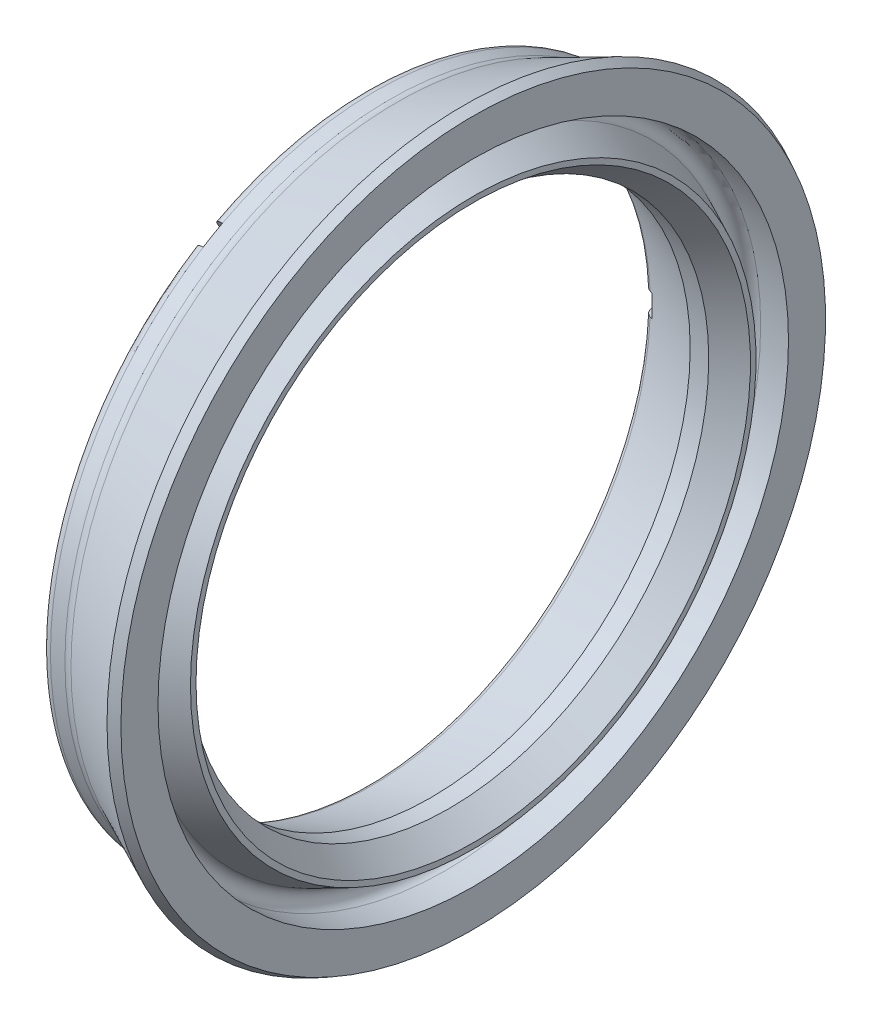
from build123d import *

# Parameters (mm, degrees)
FILLET1_R          = 1
CUT_EXTRUDE1_DEPTH = 0.1
SKETCH3_W          = 1
SKETCH3_H          = 1.2
CUT_EXTRUDE2_DEPTH = 28.834600908
CIRPATTERN1_COUNT  = 3


with BuildPart() as part:
    # Sketch1 → Revolve1 (revolve)
    with BuildSketch(Plane.XY):
        with BuildLine():
            Line((0, 15.47657924), (0, 17))
            ThreePointArc((0, 17), (0.146446609, 17.353553391), (0.5, 17.5))
            Line((0.5, 17.5), (1.5, 17.5))
            Line((1.5, 17.5), (5.3, 19.25))
            Line((5.3, 19.25), (5.8, 19))
            Line((5.8, 19), (5.8, 17))
            Line((5.8, 17), (4.3, 17))
            ThreePointArc((4.3, 17), (3.811822126, 16.608084983), (4.088941212, 16.046729454))
            Line((4.088941212, 16.046729454), (5.8, 15.25))
            Line((5.8, 15.25), (5.8, 14.95))
            Line((5.8, 14.95), (4.5, 14))
            Line((4.5, 14), (3.5, 14))
            Line((3.5, 14), (0.348764329, 15))
            ThreePointArc((0.348764329, 15), (0.096504129, 15.181297879), (0, 15.47657924))
        make_face()
    revolve(axis=Axis((0, 0, 0), (1, 0, 0)))

    # Fillet1
    fillet1_edges = [part.edges().sort_by_distance(p)[0] for p in [
        (1.5, -17.5, 0),
    ]]
    fillet(fillet1_edges, radius=FILLET1_R)

    # Sketch2 → Cut-Extrude1 (cut)
    # profile 1 of 13: a face of its own
    with BuildSketch(Plane.ZY):
        with BuildLine():
            Line((-5.513236692, 15.646736619), (-5.363557205, 15.696576363))
            add(Edge.make_bspline(
                [(-5.363557205, 15.696576363), (-5.353512255, 15.699826939), (-5.334289843, 15.70604737), (-5.30673904, 15.715099859), (-5.281364662, 15.72228272), (-5.258570361, 15.728853183), (-5.238105187, 15.733868692), (-5.220182011, 15.738282269), (-5.204518152, 15.740934727), (-5.1948641, 15.742169507), (-5.190480282, 15.742730209)],
                knots=[0, 0, 0, 0, 1.412503745, 2.703022838, 3.879057233, 4.940239887, 5.876218095, 6.697914565, 7.408734662, 8, 8, 8, 8], degree=3))
            add(Edge.make_bspline(
                [(-5.190480282, 15.742730209), (-5.184555288, 15.743203754), (-5.172822615, 15.744141467), (-5.155334297, 15.743794102), (-5.13832217, 15.741943867), (-5.121723228, 15.739167961), (-5.105588102, 15.734773302), (-5.089895179, 15.728996409), (-5.074596319, 15.721869467), (-5.059739804, 15.71362487), (-5.045598172, 15.704010342), (-5.032524099, 15.693098164), (-5.0203499, 15.681188019), (-5.009401397, 15.667970954), (-4.999722953, 15.653478799), (-4.990770581, 15.638031924), (-4.983107815, 15.621303853), (-4.97885988, 15.609588993), (-4.976698231, 15.603627645)],
                knots=[0, 0, 0, 0, 1.02975508, 2.039121114, 3.025811522, 3.993908284, 4.952930606, 5.919565219, 6.888900862, 7.875417496, 8.861543025, 9.847842398, 10.823348846, 11.809648219, 12.816292897, 13.840664528, 14.901177562, 16, 16, 16, 16], degree=3))
            add(Edge.make_bspline(
                [(-4.976698231, 15.603627645), (-4.973678409, 15.59359914), (-4.967765538, 15.573963128), (-4.964063446, 15.54390869), (-4.964249386, 15.514506201), (-4.968890484, 15.485953365), (-4.977814283, 15.458720436), (-4.990531553, 15.43294728), (-5.007870572, 15.40935199), (-5.025165341, 15.391139143), (-5.041252253, 15.377645777), (-5.054949222, 15.367674162), (-5.070219401, 15.358059909), (-5.087102374, 15.348865521), (-5.105305456, 15.339655945), (-5.125177032, 15.331087185), (-5.146454789, 15.322516357), (-5.161343337, 15.317346217), (-5.169005923, 15.314685337)],
                knots=[0, 0, 0, 0, 1.27216696, 2.490927996, 3.667247005, 4.839249893, 5.994210959, 7.142185145, 8.319939347, 9.542575186, 10.188263018, 10.871976625, 11.602166358, 12.381700848, 13.209986021, 14.082954318, 15.013367326, 16, 16, 16, 16], degree=3))
            Line((-5.169005923, 15.314685337), (-4.782307205, 15.055390466))
            Line((-4.782307205, 15.055390466), (-4.875416179, 15.024300722))
            Line((-4.875416179, 15.024300722), (-5.261473872, 15.283916107))
            Line((-5.261473872, 15.283916107), (-5.304262333, 15.269653286))
            Line((-5.304262333, 15.269653286), (-5.187916179, 14.920294312))
            Line((-5.187916179, 14.920294312), (-5.263076436, 14.895294312))
            Line((-5.263076436, 14.895294312), (-5.513236692, 15.646736619))
        make_face()
        with BuildLine():
            Line((-5.413557205, 15.598178927), (-5.328461051, 15.342730209))
            Line((-5.328461051, 15.342730209), (-5.198973872, 15.384877645))
            add(Edge.make_bspline(
                [(-5.198973872, 15.384877645), (-5.192926625, 15.386929713), (-5.181260543, 15.390888474), (-5.164510314, 15.397139017), (-5.149177995, 15.403522453), (-5.135182053, 15.409955132), (-5.122528934, 15.416304245), (-5.111282356, 15.422703253), (-5.1013875, 15.429119234), (-5.090196069, 15.437762932), (-5.078266711, 15.449489769), (-5.066333554, 15.464919175), (-5.057467632, 15.482068176), (-5.05124012, 15.500328868), (-5.047686483, 15.519392357), (-5.047079556, 15.538827702), (-5.049231306, 15.558419166), (-5.05299564, 15.571086302), (-5.054903359, 15.57750585)],
                knots=[0, 0, 0, 0, 1.11744946, 2.155734408, 3.127910899, 4.023013382, 4.850760167, 5.604407998, 6.286288709, 6.912664474, 8.076087043, 9.203462662, 10.311488627, 11.43777859, 12.569023046, 13.691388168, 14.83002394, 16, 16, 16, 16], degree=3))
            add(Edge.make_bspline(
                [(-5.054903359, 15.57750585), (-5.057187423, 15.58356699), (-5.061703863, 15.595552107), (-5.071477172, 15.612070753), (-5.083626091, 15.626787638), (-5.097910813, 15.639532291), (-5.113614236, 15.650218151), (-5.130424906, 15.658421386), (-5.148216393, 15.663522682), (-5.163699372, 15.665743048), (-5.176980519, 15.66596657), (-5.188217442, 15.665054081), (-5.200726713, 15.663426778), (-5.21448505, 15.661042908), (-5.229445635, 15.657618413), (-5.245608966, 15.653231444), (-5.263085147, 15.648114458), (-5.275104362, 15.644254058), (-5.281345667, 15.64224944)],
                knots=[0, 0, 0, 0, 1.15589625, 2.285634727, 3.41141331, 4.553866835, 5.695083182, 6.796720813, 7.881224103, 8.989665977, 9.581636446, 10.251605876, 11.002340783, 11.835749139, 12.74594281, 13.74401499, 14.828518281, 16, 16, 16, 16], degree=3))
            Line((-5.281345667, 15.64224944), (-5.413557205, 15.598178927))
        make_face(mode=Mode.SUBTRACT)
    # profile 2 of 13: a face of its own
    with BuildSketch(Plane.ZY):
        Polygon((-4.846118454, 15.87339904), (-4.769035121, 15.895995193), (-4.566631275, 15.203847757), (-4.272400506, 15.28990545), (-4.25076589, 15.215866988), (-4.622079993, 15.107213142), align=None)
    # profile 3 of 13: a face of its own
    with BuildSketch(Plane.ZY):
        Polygon((-4.12826997, 15.248587983), (-4.319616124, 16.022145675), (-4.3027892, 16.026312342), (-3.642052021, 15.561408495), (-3.78852638, 16.153555931), (-3.712404585, 16.172466188), (-3.521058431, 15.398908495), (-3.538366124, 15.394581572), (-4.193173816, 15.853075162), (-4.048462277, 15.268299521), align=None)
    # profile 4 of 13: a face of its own
    with BuildSketch(Plane.ZY):
        Polygon((-3.241907405, 16.195323355), (-3.256009969, 16.271284893), (-2.827484328, 16.350772073), (-2.813381764, 16.274810534), (-2.987580482, 16.242598996), (-2.856811251, 15.537631047), (-2.936458687, 15.522727201), (-3.067227918, 16.22769515), align=None)
    # profile 5 of 13: a face of its own
    with BuildSketch(Plane.ZY):
        with BuildLine():
            Line((-2.671946245, 15.722817863), (-2.611048809, 15.773138376))
            add(Edge.make_bspline(
                [(-2.611048809, 15.773138376), (-2.603664835, 15.763773446), (-2.589494957, 15.745802101), (-2.566776036, 15.721931274), (-2.543740059, 15.702457526), (-2.520955937, 15.686685633), (-2.497768328, 15.675388744), (-2.474446557, 15.668460999), (-2.4509956, 15.665144266), (-2.435567434, 15.666735896), (-2.427875732, 15.667529402)],
                knots=[0, 0, 0, 0, 1.288691563, 2.473004974, 3.554644125, 4.544373842, 5.461179188, 6.328941456, 7.166894914, 8, 8, 8, 8], degree=3))
            add(Edge.make_bspline(
                [(-2.427875732, 15.667529402), (-2.42136949, 15.66874991), (-2.408462352, 15.671171164), (-2.389979592, 15.677740916), (-2.372430116, 15.686316454), (-2.356086022, 15.696989338), (-2.341224987, 15.709311555), (-2.328638567, 15.723241683), (-2.318159235, 15.738316488), (-2.310221146, 15.75462082), (-2.304666775, 15.771634812), (-2.30115565, 15.788892763), (-2.300342339, 15.806350962), (-2.301603415, 15.817858501), (-2.302234706, 15.823619146)],
                knots=[0, 0, 0, 0, 1.06857833, 2.119854591, 3.158575294, 4.219486941, 5.267496156, 6.269950155, 7.244691588, 8.225494358, 9.189314404, 10.130792963, 11.064279774, 12, 12, 12, 12], degree=3))
            add(Edge.make_bspline(
                [(-2.302234706, 15.823619146), (-2.303549995, 15.830205328), (-2.306199835, 15.843474155), (-2.314582789, 15.862424986), (-2.326072331, 15.880607614), (-2.335826119, 15.891539083), (-2.340856501, 15.897176838)],
                knots=[0, 0, 0, 0, 0.952754949, 1.919464252, 2.926992132, 4, 4, 4, 4], degree=3))
            add(Edge.make_bspline(
                [(-2.340856501, 15.897176838), (-2.344863277, 15.901239094), (-2.353286251, 15.909778697), (-2.367658182, 15.922060743), (-2.384062282, 15.934580606), (-2.402134354, 15.947925525), (-2.422660902, 15.960990234), (-2.444801296, 15.975088902), (-2.469262455, 15.989058739), (-2.486250425, 15.998428138), (-2.495023168, 16.003266581)],
                knots=[0, 0, 0, 0, 0.728852602, 1.532181004, 2.412844785, 3.36587699, 4.401500804, 5.520844961, 6.719741597, 8, 8, 8, 8], degree=3))
            add(Edge.make_bspline(
                [(-2.495023168, 16.003266581), (-2.503738321, 16.008059633), (-2.5204188, 16.017233358), (-2.544175594, 16.030597424), (-2.565240377, 16.043308299), (-2.583988445, 16.054796313), (-2.600067731, 16.065523805), (-2.613818182, 16.075081253), (-2.624961543, 16.083798813), (-2.631171367, 16.089709592), (-2.633965476, 16.092369146)],
                knots=[0, 0, 0, 0, 1.44282243, 2.761508766, 3.953561538, 5.011511632, 5.950700909, 6.756925759, 7.440679047, 8, 8, 8, 8], degree=3))
            add(Edge.make_bspline(
                [(-2.633965476, 16.092369146), (-2.638053625, 16.096516423), (-2.646092205, 16.104671266), (-2.656580727, 16.117983486), (-2.666216962, 16.13144091), (-2.67435233, 16.145586436), (-2.681295329, 16.160208239), (-2.686866565, 16.175289037), (-2.691333969, 16.190810165), (-2.693146221, 16.20142861), (-2.694061629, 16.206792222)],
                knots=[0, 0, 0, 0, 1.061424028, 2.087091596, 3.087310901, 4.078375562, 5.059087508, 6.036453711, 7.008169225, 8, 8, 8, 8], degree=3))
            add(Edge.make_bspline(
                [(-2.694061629, 16.206792222), (-2.695035966, 16.215220281), (-2.696963121, 16.231890271), (-2.69587995, 16.256807547), (-2.691722405, 16.281080108), (-2.684143757, 16.304403877), (-2.673628887, 16.326565175), (-2.660016361, 16.346915354), (-2.643610149, 16.365381548), (-2.62459858, 16.381832925), (-2.603337723, 16.395758073), (-2.580621642, 16.407414205), (-2.55620613, 16.415573335), (-2.539298543, 16.418789752), (-2.530760347, 16.420414017)],
                knots=[0, 0, 0, 0, 1.01690912, 2.011360742, 2.981036102, 3.964348783, 4.94504557, 5.915885858, 6.892319502, 7.901316391, 8.923727641, 9.935815627, 10.957603584, 12, 12, 12, 12], degree=3))
            add(Edge.make_bspline(
                [(-2.530760347, 16.420414017), (-2.521531443, 16.421467195), (-2.503259914, 16.423552294), (-2.475706936, 16.422240471), (-2.44859497, 16.417634896), (-2.42641462, 16.410621463), (-2.408719005, 16.402978082), (-2.394985559, 16.395660783), (-2.380632683, 16.387237248), (-2.366161684, 16.377028854), (-2.351119868, 16.365623351), (-2.335868844, 16.352623516), (-2.320074464, 16.338327899), (-2.30967613, 16.328092167), (-2.30431804, 16.322817863)],
                knots=[0, 0, 0, 0, 1.298473385, 2.57073777, 3.845548619, 5.139168525, 5.81567184, 6.541458679, 7.316028279, 8.143643809, 9.018551655, 9.957783479, 10.94767955, 12, 12, 12, 12], degree=3))
            Line((-2.30431804, 16.322817863), (-2.361369322, 16.264164017))
            add(Edge.make_bspline(
                [(-2.361369322, 16.264164017), (-2.365661711, 16.268367635), (-2.373954653, 16.276489069), (-2.386517005, 16.287644625), (-2.398296917, 16.297792595), (-2.409569373, 16.306608312), (-2.420156371, 16.314381041), (-2.430190894, 16.320946982), (-2.439641568, 16.326311009), (-2.451428986, 16.331630833), (-2.465933418, 16.3364649), (-2.483702102, 16.339883238), (-2.501847861, 16.340985833), (-2.513942085, 16.339560283), (-2.520023168, 16.338843505)],
                knots=[0, 0, 0, 0, 1.18295961, 2.285490489, 3.307868454, 4.244373529, 5.102887989, 5.893629838, 6.604791931, 7.240352481, 8.437955826, 9.605709123, 10.796129332, 12, 12, 12, 12], degree=3))
            add(Edge.make_bspline(
                [(-2.520023168, 16.338843505), (-2.527573944, 16.337343699), (-2.542203826, 16.334437776), (-2.562430684, 16.325847748), (-2.579792941, 16.313737107), (-2.594041792, 16.29861914), (-2.604972854, 16.281369893), (-2.612063031, 16.262622869), (-2.614897015, 16.242629089), (-2.613625401, 16.229225532), (-2.612971886, 16.222337094)],
                knots=[0, 0, 0, 0, 1.107297554, 2.145426364, 3.140622782, 4.13715817, 5.119648922, 6.064816567, 7.005458845, 8, 8, 8, 8], degree=3))
            add(Edge.make_bspline(
                [(-2.612971886, 16.222337094), (-2.612202231, 16.21809835), (-2.610662448, 16.209618254), (-2.606814714, 16.197213897), (-2.601368164, 16.185351393), (-2.594976, 16.173516774), (-2.586457222, 16.161989305), (-2.575600249, 16.150626296), (-2.562885954, 16.138664636), (-2.553063826, 16.131320527), (-2.547907783, 16.127465299)],
                knots=[0, 0, 0, 0, 0.872587305, 1.745711669, 2.622853498, 3.514505474, 4.467220835, 5.516635358, 6.696378744, 8, 8, 8, 8], degree=3))
            add(Edge.make_bspline(
                [(-2.547907783, 16.127465299), (-2.546047053, 16.126222555), (-2.541534676, 16.123208829), (-2.533339887, 16.118357195), (-2.522855336, 16.112053572), (-2.509728024, 16.104894326), (-2.494226774, 16.096420598), (-2.476313834, 16.086631352), (-2.455953408, 16.075747509), (-2.441555207, 16.068162373), (-2.433965476, 16.064164017)],
                knots=[0, 0, 0, 0, 0.411805356, 0.998651362, 1.752449467, 2.663563296, 3.750432432, 5.004451759, 6.420955217, 8, 8, 8, 8], degree=3))
            add(Edge.make_bspline(
                [(-2.433965476, 16.064164017), (-2.42480239, 16.059248117), (-2.407032645, 16.049714832), (-2.381710327, 16.035027365), (-2.358611861, 16.02033796), (-2.337379965, 16.006184673), (-2.31834248, 15.992053633), (-2.301245517, 15.97836834), (-2.286419291, 15.96465328), (-2.269635476, 15.947065178), (-2.252014725, 15.924758049), (-2.235400893, 15.896792025), (-2.223485021, 15.867886026), (-2.219450227, 15.847903535), (-2.217459065, 15.838042222)],
                knots=[0, 0, 0, 0, 1.151684521, 2.233433325, 3.241286996, 4.183214275, 5.058889084, 5.866497739, 6.607584165, 7.293908213, 8.558010172, 9.746242845, 10.887776133, 12, 12, 12, 12], degree=3))
            add(Edge.make_bspline(
                [(-2.217459065, 15.838042222), (-2.216549013, 15.830949187), (-2.214754323, 15.816961203), (-2.214899176, 15.796000205), (-2.216896046, 15.775468433), (-2.221326976, 15.755346658), (-2.227726065, 15.735574181), (-2.236342807, 15.716234243), (-2.246919593, 15.697231844), (-2.259707837, 15.67902601), (-2.273981818, 15.661782765), (-2.28969544, 15.646194931), (-2.306650535, 15.632518283), (-2.324658381, 15.620512782), (-2.344016623, 15.610623823), (-2.364426961, 15.602393465), (-2.386070419, 15.596072441), (-2.401029363, 15.593406078), (-2.408644963, 15.592048633)],
                knots=[0, 0, 0, 0, 0.991030523, 1.954384536, 2.900425006, 3.848089382, 4.80655723, 5.778678344, 6.780592826, 7.818712427, 8.860501939, 9.882306608, 10.883398612, 11.878162364, 12.879089792, 13.893261398, 14.927459153, 16, 16, 16, 16], degree=3))
            add(Edge.make_bspline(
                [(-2.408644963, 15.592048633), (-2.414565839, 15.591264609), (-2.426320435, 15.589708102), (-2.443950387, 15.58896861), (-2.461359248, 15.5894109), (-2.478537086, 15.591241681), (-2.495533623, 15.594060196), (-2.512250064, 15.598250472), (-2.528681678, 15.603752054), (-2.544935594, 15.610495863), (-2.561116923, 15.618712715), (-2.577115475, 15.628744489), (-2.593148277, 15.640273379), (-2.609085601, 15.653517487), (-2.624910152, 15.668463051), (-2.640757494, 15.685019016), (-2.656716479, 15.703096912), (-2.666784554, 15.716134015), (-2.671946245, 15.722817863)],
                knots=[0, 0, 0, 0, 0.922784599, 1.831985782, 2.724079254, 3.612228186, 4.49999322, 5.385143329, 6.272908363, 7.176090771, 8.102966744, 9.074482647, 10.091930632, 11.153356952, 12.274903502, 13.454519411, 14.694985505, 16, 16, 16, 16], degree=3))
        make_face()
    # profile 6 of 13: a face of its own
    with BuildSketch(Plane.ZY):
        with BuildLine():
            Line((-2.117661149, 15.806186695), (-2.055321405, 15.854263618))
            add(Edge.make_bspline(
                [(-2.055321405, 15.854263618), (-2.048280453, 15.844618834), (-2.034834765, 15.826200762), (-2.012842327, 15.80188774), (-1.990940117, 15.78138578), (-1.968588104, 15.765244166), (-1.946041967, 15.752967859), (-1.923118694, 15.745249235), (-1.899879014, 15.74134505), (-1.884496621, 15.742371529), (-1.876795764, 15.742885413)],
                knots=[0, 0, 0, 0, 1.295937375, 2.474774577, 3.554503821, 4.547811905, 5.461281618, 6.330796038, 7.164349725, 8, 8, 8, 8], degree=3))
            add(Edge.make_bspline(
                [(-1.876795764, 15.742885413), (-1.870299872, 15.743847533), (-1.857395027, 15.745758895), (-1.838669287, 15.751443733), (-1.820982162, 15.7595718), (-1.804312164, 15.769615258), (-1.789238902, 15.781514293), (-1.776075983, 15.794836816), (-1.765400832, 15.809658231), (-1.756915355, 15.825515075), (-1.750641677, 15.842167283), (-1.74679151, 15.859205865), (-1.745235727, 15.876476663), (-1.746081166, 15.887919179), (-1.746507303, 15.893686695)],
                knots=[0, 0, 0, 0, 1.066071586, 2.117875347, 3.166773517, 4.222296185, 5.272988879, 6.279730542, 7.255571164, 8.230368746, 9.194556658, 10.138006072, 11.061475576, 12, 12, 12, 12], degree=3))
            add(Edge.make_bspline(
                [(-1.746507303, 15.893686695), (-1.747546535, 15.900266961), (-1.749652107, 15.913599125), (-1.757412602, 15.93271783), (-1.768056068, 15.95140423), (-1.777507482, 15.962577002), (-1.782404738, 15.968366182)],
                knots=[0, 0, 0, 0, 0.946802397, 1.918300116, 2.921365801, 4, 4, 4, 4], degree=3))
            add(Edge.make_bspline(
                [(-1.782404738, 15.968366182), (-1.786243701, 15.972539976), (-1.794307818, 15.98130744), (-1.80825753, 15.993840439), (-1.823968456, 16.006992642), (-1.841652962, 16.020641632), (-1.861383962, 16.034661778), (-1.883010314, 16.049304419), (-1.906768239, 16.064135078), (-1.923358216, 16.074006526), (-1.931923969, 16.079103362)],
                knots=[0, 0, 0, 0, 0.728542829, 1.530375755, 2.407762283, 3.36228049, 4.400731542, 5.518615085, 6.718808931, 8, 8, 8, 8], degree=3))
            add(Edge.make_bspline(
                [(-1.931923969, 16.079103362), (-1.940488807, 16.0841482), (-1.956845479, 16.093782564), (-1.979945154, 16.108021246), (-2.000446029, 16.12137718), (-2.018637335, 16.133497174), (-2.034310709, 16.1447225), (-2.047662566, 16.154747038), (-2.058549242, 16.163773075), (-2.064499597, 16.169922594), (-2.067180379, 16.172693105)],
                knots=[0, 0, 0, 0, 1.446920755, 2.763252082, 3.949501576, 5.008421877, 5.944891621, 6.75515232, 7.439165103, 8, 8, 8, 8], degree=3))
            add(Edge.make_bspline(
                [(-2.067180379, 16.172693105), (-2.071025067, 16.176975115), (-2.078610816, 16.18542372), (-2.088942131, 16.198707029), (-2.09778652, 16.212578429), (-2.105330323, 16.226919629), (-2.111748329, 16.241634492), (-2.116965834, 16.256771647), (-2.12062814, 16.27241688), (-2.122171735, 16.283043225), (-2.12294961, 16.288398234)],
                knots=[0, 0, 0, 0, 1.056223689, 2.083978464, 3.085001729, 4.071949556, 5.055676999, 6.029383188, 7.006933163, 8, 8, 8, 8], degree=3))
            add(Edge.make_bspline(
                [(-2.12294961, 16.288398234), (-2.123588664, 16.296833207), (-2.124847351, 16.313446831), (-2.123052801, 16.338275996), (-2.117833002, 16.362220234), (-2.109716522, 16.385316708), (-2.098256986, 16.406835427), (-2.084296827, 16.426843718), (-2.067195767, 16.444559268), (-2.047684029, 16.460198068), (-2.026110798, 16.47348529), (-2.002954076, 16.483910532), (-1.978454471, 16.491497874), (-1.961510634, 16.494013472), (-1.952917559, 16.495289259)],
                knots=[0, 0, 0, 0, 1.018300889, 2.005657442, 2.986593979, 3.963827857, 4.945629855, 5.915373283, 6.89419573, 7.90145137, 8.921500277, 9.938437255, 10.954477535, 12, 12, 12, 12], degree=3))
            add(Edge.make_bspline(
                [(-1.952917559, 16.495289259), (-1.943736652, 16.49599444), (-1.925471443, 16.497397381), (-1.898077746, 16.495513793), (-1.871346123, 16.48944395), (-1.849409435, 16.48198952), (-1.832081021, 16.473647261), (-1.818502621, 16.466132782), (-1.804830694, 16.456877968), (-1.790593951, 16.446492259), (-1.776293985, 16.43433265), (-1.761331467, 16.421142827), (-1.746265451, 16.406262526), (-1.73627459, 16.395744864), (-1.731122687, 16.39032131)],
                knots=[0, 0, 0, 0, 1.294010184, 2.574404483, 3.843218279, 5.14056116, 5.822759798, 6.545926181, 7.321080821, 8.143029026, 9.023209428, 9.959720845, 10.947906555, 12, 12, 12, 12], degree=3))
            Line((-1.731122687, 16.39032131), (-1.78993679, 16.333911054))
            add(Edge.make_bspline(
                [(-1.78993679, 16.333911054), (-1.794081602, 16.338205836), (-1.80210894, 16.346523623), (-1.814062465, 16.358195549), (-1.82551651, 16.368585541), (-1.836131984, 16.378072533), (-1.846688806, 16.38579407), (-1.856345949, 16.392760056), (-1.865514201, 16.398470631), (-1.877042502, 16.404176599), (-1.89129978, 16.409569995), (-1.908851343, 16.413688265), (-1.926902633, 16.415170582), (-1.938978944, 16.414205244), (-1.945064995, 16.413718746)],
                knots=[0, 0, 0, 0, 1.181060523, 2.28738276, 3.304899168, 4.24162624, 5.102067028, 5.89096869, 6.598007516, 7.236188765, 8.433784188, 9.605584328, 10.793295843, 12, 12, 12, 12], degree=3))
            add(Edge.make_bspline(
                [(-1.945064995, 16.413718746), (-1.95266314, 16.412495036), (-1.967289273, 16.410139441), (-1.987683707, 16.402241705), (-2.005480047, 16.390922837), (-2.020126232, 16.376205864), (-2.031781885, 16.359562118), (-2.039305031, 16.341059386), (-2.043053467, 16.321331527), (-2.04215691, 16.307906224), (-2.04169961, 16.30105849)],
                knots=[0, 0, 0, 0, 1.111055437, 2.138738395, 3.139952462, 4.140092008, 5.124094357, 6.059898599, 7.010428353, 8, 8, 8, 8], degree=3))
            add(Edge.make_bspline(
                [(-2.04169961, 16.30105849), (-2.041025201, 16.296824725), (-2.039679901, 16.288379286), (-2.036336179, 16.275916962), (-2.031387491, 16.263931014), (-2.025504418, 16.251931477), (-2.017371415, 16.24016687), (-2.007044173, 16.228421613), (-1.994549969, 16.216265159), (-1.98513795, 16.208519535), (-1.980161149, 16.204423875)],
                knots=[0, 0, 0, 0, 0.872436595, 1.740320901, 2.618700777, 3.508648899, 4.455692365, 5.519574373, 6.688423081, 8, 8, 8, 8], degree=3))
            add(Edge.make_bspline(
                [(-1.980161149, 16.204423875), (-1.978352156, 16.203131328), (-1.973939112, 16.199978154), (-1.966019954, 16.194807668), (-1.955683562, 16.18838411), (-1.943017644, 16.180699389), (-1.92794757, 16.171734202), (-1.910475479, 16.161484249), (-1.890602347, 16.149947637), (-1.876532078, 16.141864547), (-1.869103456, 16.137596952)],
                knots=[0, 0, 0, 0, 0.411533696, 1.003937973, 1.750243138, 2.664330048, 3.74629903, 4.996209984, 6.414101526, 8, 8, 8, 8], degree=3))
            add(Edge.make_bspline(
                [(-1.869103456, 16.137596952), (-1.860146584, 16.132367816), (-1.84283177, 16.122259207), (-1.818258285, 16.106604768), (-1.79565841, 16.091445797), (-1.775049694, 16.076580743), (-1.756680534, 16.061830131), (-1.74018254, 16.047538862), (-1.725735765, 16.033556199), (-1.709729062, 16.015366686), (-1.69304932, 15.992528499), (-1.677456405, 15.964152115), (-1.666397725, 15.935015637), (-1.66316817, 15.914973961), (-1.661571405, 15.9050649)],
                knots=[0, 0, 0, 0, 1.153800331, 2.230448103, 3.240890569, 4.181207033, 5.056467584, 5.860992655, 6.609076037, 7.291168816, 8.554828241, 9.746310005, 10.885724426, 12, 12, 12, 12], degree=3))
            add(Edge.make_bspline(
                [(-1.661571405, 15.9050649), (-1.660948231, 15.898020223), (-1.659712455, 15.8840504), (-1.660372168, 15.863187863), (-1.663328432, 15.842793249), (-1.668259756, 15.822901971), (-1.675435156, 15.803491763), (-1.684600136, 15.784542493), (-1.695881014, 15.765994996), (-1.709247811, 15.748331234), (-1.724036158, 15.731646017), (-1.740237462, 15.716774826), (-1.757465115, 15.70365169), (-1.775913085, 15.692525619), (-1.795453942, 15.683238933), (-1.816116396, 15.675828563), (-1.837864814, 15.670332171), (-1.852839612, 15.668178566), (-1.86044961, 15.667084131)],
                knots=[0, 0, 0, 0, 0.984887516, 1.95306374, 2.900528537, 3.851991154, 4.803424651, 5.778927765, 6.781105114, 7.82326322, 8.861826059, 9.883850431, 10.882843399, 11.874794749, 12.880366839, 13.892858464, 14.929177954, 16, 16, 16, 16], degree=3))
            add(Edge.make_bspline(
                [(-1.86044961, 15.667084131), (-1.866373784, 15.666509072), (-1.878096605, 15.665371138), (-1.895666548, 15.665325965), (-1.912967175, 15.666203798), (-1.930005479, 15.668468256), (-1.946722965, 15.671995581), (-1.963164094, 15.676842395), (-1.979309939, 15.682960828), (-1.99531522, 15.690192037), (-2.011141146, 15.698867663), (-2.026668232, 15.709369434), (-2.042089963, 15.721477247), (-2.057521828, 15.735154889), (-2.072862345, 15.750482989), (-2.087908353, 15.767621518), (-2.103018732, 15.786202632), (-2.112697239, 15.799411919), (-2.117661149, 15.806186695)],
                knots=[0, 0, 0, 0, 0.924478986, 1.829369331, 2.7273027, 3.61489247, 4.497343069, 5.37994984, 6.275770195, 7.178525643, 8.107392238, 9.076702533, 10.088008949, 11.15243451, 12.279469531, 13.455575636, 14.695016177, 16, 16, 16, 16], degree=3))
        make_face()
    # profile 7 of 13: a face of its own
    with BuildSketch(Plane.ZY):
        with BuildLine():
            Line((-0.846522684, 16.323067635), (-0.922804736, 16.319862507))
            add(Edge.make_bspline(
                [(-0.922804736, 16.319862507), (-0.922766667, 16.329485727), (-0.9226918, 16.348411249), (-0.919574274, 16.376206981), (-0.914132603, 16.402754965), (-0.906401502, 16.428081631), (-0.896456041, 16.452193621), (-0.884240031, 16.475116556), (-0.86950791, 16.496710438), (-0.85262081, 16.516912095), (-0.833970245, 16.535385419), (-0.814075057, 16.551838033), (-0.792947079, 16.565920488), (-0.770503351, 16.57749588), (-0.746865772, 16.586794259), (-0.722035715, 16.593890774), (-0.695992273, 16.598618264), (-0.67816563, 16.599741299), (-0.669118838, 16.600311224)],
                knots=[0, 0, 0, 0, 1.095762027, 2.154982024, 3.180280664, 4.179452284, 5.167271325, 6.147486722, 7.133297637, 8.140076897, 9.142801007, 10.119988705, 11.07706948, 12.029786421, 12.991557898, 13.966316665, 14.967931975, 16, 16, 16, 16], degree=3))
            add(Edge.make_bspline(
                [(-0.669118838, 16.600311224), (-0.660194002, 16.600475992), (-0.642685753, 16.600799224), (-0.616931403, 16.598470462), (-0.59239096, 16.594061866), (-0.56904743, 16.587309502), (-0.547000015, 16.578086986), (-0.52607553, 16.566693894), (-0.506411413, 16.552983646), (-0.488265162, 16.537127473), (-0.471760776, 16.519795018), (-0.45703426, 16.501458733), (-0.444462834, 16.4821366), (-0.434026705, 16.461882936), (-0.425641172, 16.440789648), (-0.41937714, 16.418836357), (-0.415122984, 16.396025259), (-0.414051502, 16.380456779), (-0.413509864, 16.372586865)],
                knots=[0, 0, 0, 0, 1.120278774, 2.197700727, 3.241109536, 4.247347955, 5.242750095, 6.23641018, 7.233867188, 8.246725009, 9.257358916, 10.235867935, 11.195969151, 12.147052259, 13.092535686, 14.041629474, 15.010037753, 16, 16, 16, 16], degree=3))
            add(Edge.make_bspline(
                [(-0.413509864, 16.372586865), (-0.413421126, 16.36145855), (-0.413244858, 16.339353496), (-0.41833281, 16.306612058), (-0.427154162, 16.274724246), (-0.438141118, 16.248811221), (-0.449438092, 16.227862583), (-0.459844194, 16.210681898), (-0.471721699, 16.191948137), (-0.485889297, 16.172055334), (-0.501644223, 16.150597057), (-0.519539392, 16.127901828), (-0.539067258, 16.10368073), (-0.552852701, 16.087201624), (-0.559984223, 16.078676609)],
                knots=[0, 0, 0, 0, 1.187312782, 2.358453232, 3.525763252, 4.715063285, 5.35594674, 6.067515513, 6.860669717, 7.725170813, 8.67601155, 9.704650471, 10.812563774, 12, 12, 12, 12], degree=3))
            Line((-0.559984223, 16.078676609), (-0.748926531, 15.856721481))
            Line((-0.748926531, 15.856721481), (-0.381618838, 15.872106096))
            Line((-0.381618838, 15.872106096), (-0.37841371, 15.795343276))
            Line((-0.37841371, 15.795343276), (-0.918798326, 15.772747122))
            Line((-0.918798326, 15.772747122), (-0.628573967, 16.113772763))
            add(Edge.make_bspline(
                [(-0.628573967, 16.113772763), (-0.621487747, 16.122023266), (-0.607872588, 16.137875427), (-0.588845442, 16.161145296), (-0.571656022, 16.18268352), (-0.556245745, 16.202367863), (-0.543065693, 16.220631406), (-0.531700465, 16.237061505), (-0.522105373, 16.251760772), (-0.5123658, 16.269175235), (-0.502759976, 16.290000214), (-0.49523315, 16.315529798), (-0.490797479, 16.341444525), (-0.490874969, 16.358894776), (-0.49091371, 16.367618917)],
                knots=[0, 0, 0, 0, 1.322307332, 2.540624395, 3.654369914, 4.672896342, 5.57970304, 6.392220212, 7.102073265, 7.712736129, 8.81735399, 9.881771995, 10.941005487, 12, 12, 12, 12], degree=3))
            add(Edge.make_bspline(
                [(-0.49091371, 16.367618917), (-0.491272136, 16.373135348), (-0.491976621, 16.383977863), (-0.49513637, 16.399873301), (-0.499789476, 16.415107359), (-0.505885011, 16.429719936), (-0.513447794, 16.443715179), (-0.522911118, 16.456819428), (-0.53358352, 16.469510709), (-0.545733297, 16.481299011), (-0.558947074, 16.491944884), (-0.572891754, 16.501329443), (-0.587595791, 16.509023755), (-0.60285579, 16.515342288), (-0.618814928, 16.520013789), (-0.635416448, 16.522983929), (-0.652630265, 16.524708033), (-0.66430755, 16.524470416), (-0.670240633, 16.524349686)],
                knots=[0, 0, 0, 0, 1.00111568, 1.967687352, 2.929445704, 3.884306838, 4.83325851, 5.805777181, 6.808764107, 7.835858298, 8.868687184, 9.88111737, 10.877304306, 11.871654344, 12.870519902, 13.884661799, 14.925222936, 16, 16, 16, 16], degree=3))
            add(Edge.make_bspline(
                [(-0.670240633, 16.524349686), (-0.676447604, 16.52391794), (-0.688658122, 16.523068599), (-0.70656288, 16.520049359), (-0.723513969, 16.515238316), (-0.739561944, 16.508852732), (-0.754907612, 16.501279291), (-0.769151782, 16.491639663), (-0.782735265, 16.480772655), (-0.795148714, 16.468219627), (-0.806617139, 16.454481574), (-0.816537308, 16.439258239), (-0.825259681, 16.422953545), (-0.832254656, 16.405273524), (-0.838092897, 16.386485937), (-0.842275655, 16.366404456), (-0.845495987, 16.345170576), (-0.846174723, 16.330558603), (-0.846522684, 16.323067635)],
                knots=[0, 0, 0, 0, 1.002496923, 1.972138307, 2.920677001, 3.836852859, 4.753311893, 5.672718852, 6.603266658, 7.553055075, 8.513284666, 9.482849589, 10.47658183, 11.488683513, 12.542695723, 13.643802067, 14.792072555, 16, 16, 16, 16], degree=3))
        make_face()
    # profile 8 of 13: a face of its own
    with BuildSketch(Plane.ZY):
        with BuildLine():
            add(Edge.make_bspline(
                [(0.081182045, 16.242046008), (0.087730284, 16.238631618), (0.100501538, 16.231972418), (0.118690614, 16.221249943), (0.135313471, 16.209949151), (0.150831314, 16.198603811), (0.164971508, 16.186779434), (0.177575945, 16.174428998), (0.188955973, 16.161860782), (0.198882095, 16.148861962), (0.2076128, 16.13546707), (0.215158431, 16.121640951), (0.221608078, 16.107413903), (0.226719607, 16.092630628), (0.230930302, 16.077508282), (0.233827583, 16.061851601), (0.235385736, 16.045763751), (0.235680322, 16.034890997), (0.23582948, 16.029385752)],
                knots=[0, 0, 0, 0, 1.272397273, 2.481599622, 3.635517121, 4.734568067, 5.792894095, 6.808321871, 7.773003508, 8.711915296, 9.623354172, 10.525449501, 11.423591555, 12.311487226, 13.218079475, 14.126165749, 15.051214107, 16, 16, 16, 16], degree=3))
            add(Edge.make_bspline(
                [(0.23582948, 16.029385752), (0.235653156, 16.021683413), (0.235304143, 16.006437594), (0.232264147, 15.983935626), (0.227712609, 15.962081504), (0.221065863, 15.940880021), (0.212445659, 15.920448164), (0.201822383, 15.900768444), (0.189796964, 15.881518316), (0.18013931, 15.869673882), (0.175252557, 15.863680624)],
                knots=[0, 0, 0, 0, 1.025265484, 2.029385089, 3.018602448, 3.995076438, 4.983346944, 5.966715145, 6.97116228, 8, 8, 8, 8], degree=3))
            add(Edge.make_bspline(
                [(0.175252557, 15.863680624), (0.168889935, 15.856687761), (0.156243314, 15.842788448), (0.134578645, 15.824742549), (0.110802214, 15.809576973), (0.085006024, 15.797217683), (0.057259029, 15.787598058), (0.027567143, 15.780685482), (-0.004127521, 15.77672607), (-0.025911629, 15.77615373), (-0.037087186, 15.775860111)],
                knots=[0, 0, 0, 0, 0.954267603, 1.896743057, 2.838368354, 3.796610408, 4.779680527, 5.799409237, 6.871065594, 8, 8, 8, 8], degree=3))
            add(Edge.make_bspline(
                [(-0.037087186, 15.775860111), (-0.047833104, 15.776123534), (-0.068743567, 15.77663613), (-0.099179654, 15.780109143), (-0.127550641, 15.786195512), (-0.154021491, 15.794525709), (-0.178432621, 15.805362332), (-0.200714473, 15.818849968), (-0.221188523, 15.834445727), (-0.239233432, 15.852597516), (-0.255253647, 15.872039315), (-0.269326345, 15.892096826), (-0.281023277, 15.912771879), (-0.290926614, 15.933756192), (-0.298507876, 15.955343884), (-0.303758667, 15.977423887), (-0.307093367, 15.999957634), (-0.307537055, 16.015164869), (-0.307760263, 16.022815239)],
                knots=[0, 0, 0, 0, 1.256902934, 2.445805442, 3.576955095, 4.645999104, 5.686449165, 6.692658513, 7.68621702, 8.689161843, 9.678783111, 10.630372946, 11.551080876, 12.453998257, 13.34127905, 14.221779781, 15.105423033, 16, 16, 16, 16], degree=3))
            add(Edge.make_bspline(
                [(-0.307760263, 16.022815239), (-0.307628176, 16.028428769), (-0.307367125, 16.039523084), (-0.305560303, 16.055913788), (-0.302655512, 16.07186719), (-0.298710493, 16.087442217), (-0.293363973, 16.10252548), (-0.286908628, 16.117188445), (-0.279381325, 16.131447668), (-0.270677058, 16.145381126), (-0.260550881, 16.158793586), (-0.249084904, 16.171912671), (-0.236049963, 16.184534812), (-0.221591069, 16.196814223), (-0.20587346, 16.208968731), (-0.188488882, 16.220341469), (-0.169898192, 16.231737576), (-0.156685528, 16.238550907), (-0.149907699, 16.242046008)],
                knots=[0, 0, 0, 0, 0.941657376, 1.861047343, 2.762797495, 3.66048619, 4.553285746, 5.444104102, 6.34607688, 7.256116206, 8.197091036, 9.162375105, 10.176350973, 11.237807142, 12.343728897, 13.50695164, 14.721116704, 16, 16, 16, 16], degree=3))
            add(Edge.make_bspline(
                [(-0.149907699, 16.242046008), (-0.159185728, 16.247105384), (-0.177150588, 16.256901751), (-0.200937888, 16.274901021), (-0.221370031, 16.294395379), (-0.237885395, 16.315796475), (-0.250884761, 16.33843576), (-0.2598033, 16.36217159), (-0.265836782, 16.386563844), (-0.266434456, 16.403228118), (-0.266734622, 16.41159729)],
                knots=[0, 0, 0, 0, 1.166880483, 2.259407225, 3.286803203, 4.280235371, 5.237608625, 6.161067461, 7.076446754, 8, 8, 8, 8], degree=3))
            add(Edge.make_bspline(
                [(-0.266734622, 16.41159729), (-0.266360811, 16.420122446), (-0.265609385, 16.437259497), (-0.259533198, 16.462769468), (-0.249631468, 16.487824683), (-0.236163812, 16.512303703), (-0.219389591, 16.535378038), (-0.199264666, 16.556073111), (-0.176269627, 16.57420145), (-0.150519257, 16.589418861), (-0.122808118, 16.601803697), (-0.093570238, 16.610347337), (-0.063315039, 16.615932735), (-0.042721275, 16.616565113), (-0.032279494, 16.616885752)],
                knots=[0, 0, 0, 0, 0.888701115, 1.786444228, 2.72001202, 3.692817113, 4.693886446, 5.687152267, 6.695133018, 7.739871481, 8.800368666, 9.853104506, 10.91144658, 12, 12, 12, 12], degree=3))
            add(Edge.make_bspline(
                [(-0.032279494, 16.616885752), (-0.022107193, 16.616555159), (-0.002048575, 16.615903268), (0.027435911, 16.610466267), (0.055647311, 16.601385234), (0.08248834, 16.589065869), (0.107478481, 16.573891711), (0.129559009, 16.555514368), (0.149063599, 16.534910585), (0.165197175, 16.511843247), (0.178491549, 16.487458289), (0.187748898, 16.46194457), (0.193680778, 16.435853356), (0.194428975, 16.418198955), (0.194803839, 16.4093537)],
                knots=[0, 0, 0, 0, 1.072916533, 2.115669174, 3.151510826, 4.193348718, 5.225979165, 6.227137561, 7.216255879, 8.211077061, 9.189680878, 10.138522389, 11.067357538, 12, 12, 12, 12], degree=3))
            add(Edge.make_bspline(
                [(0.194803839, 16.4093537), (0.19447594, 16.40067332), (0.193831964, 16.383625547), (0.188414835, 16.35877377), (0.179291792, 16.335500162), (0.166835983, 16.31354063), (0.150601586, 16.29329343), (0.130805304, 16.274501094), (0.107604966, 16.257009248), (0.090173906, 16.247138079), (0.081182045, 16.242046008)],
                knots=[0, 0, 0, 0, 0.975232327, 1.915300861, 2.843280834, 3.77672583, 4.742871857, 5.749627742, 6.839139064, 8, 8, 8, 8], degree=3))
        make_face()
        with BuildLine():
            add(Edge.make_bspline(
                [(-0.036285904, 16.53483447), (-0.041897517, 16.534685569), (-0.052876285, 16.534394254), (-0.068974267, 16.53287228), (-0.084282237, 16.529911545), (-0.098960134, 16.525971268), (-0.11280672, 16.520648299), (-0.126010047, 16.514386583), (-0.138345404, 16.506773768), (-0.149961702, 16.498234065), (-0.160419022, 16.488841401), (-0.169700062, 16.479055408), (-0.177409346, 16.46868389), (-0.183955885, 16.457984836), (-0.188705946, 16.446640705), (-0.192263501, 16.434999293), (-0.194668391, 16.422913491), (-0.194848594, 16.414653717), (-0.19493975, 16.410475495)],
                knots=[0, 0, 0, 0, 1.203892937, 2.355340988, 3.463153438, 4.544400666, 5.610487187, 6.640501085, 7.674077295, 8.714426146, 9.728707835, 10.68524104, 11.601827946, 12.495867327, 13.368432065, 14.231010473, 15.105153427, 16, 16, 16, 16], degree=3))
            add(Edge.make_bspline(
                [(-0.19493975, 16.410475495), (-0.194782638, 16.406297093), (-0.194472161, 16.39803997), (-0.192070989, 16.385846629), (-0.188492279, 16.373864541), (-0.182857842, 16.362378618), (-0.176099818, 16.350990422), (-0.167758909, 16.339984574), (-0.15781856, 16.329322772), (-0.146612288, 16.319095699), (-0.134403936, 16.309518839), (-0.121470441, 16.301204969), (-0.107974122, 16.294248601), (-0.09405365, 16.288459023), (-0.079567147, 16.283958466), (-0.064603382, 16.280765632), (-0.049159838, 16.278781176), (-0.038695706, 16.278544142), (-0.033401289, 16.278424213)],
                knots=[0, 0, 0, 0, 0.873023192, 1.725219244, 2.590779336, 3.480155217, 4.391973325, 5.357036234, 6.360879153, 7.436073238, 8.526419356, 9.601555421, 10.645666583, 11.697338044, 12.750135903, 13.812665442, 14.89329948, 16, 16, 16, 16], degree=3))
            add(Edge.make_bspline(
                [(-0.033401289, 16.278424213), (-0.026601265, 16.278623726), (-0.013068381, 16.27902078), (0.00688118, 16.282712477), (0.026278356, 16.288519544), (0.04491582, 16.296464679), (0.062311154, 16.306436761), (0.077817455, 16.318375737), (0.091302459, 16.332005931), (0.102626027, 16.34711515), (0.111405421, 16.363195513), (0.11824012, 16.379332723), (0.122231255, 16.395698947), (0.122751841, 16.406662825), (0.123008968, 16.412078059)],
                knots=[0, 0, 0, 0, 1.076279235, 2.141928126, 3.20205304, 4.278698113, 5.344010996, 6.36967002, 7.368914609, 8.37248503, 9.349703398, 10.264243087, 11.142681841, 12, 12, 12, 12], degree=3))
            add(Edge.make_bspline(
                [(0.123008968, 16.412078059), (0.122887391, 16.415878753), (0.122646079, 16.423422586), (0.120657495, 16.434562784), (0.11737159, 16.445449546), (0.112922886, 16.456172808), (0.107069219, 16.466582118), (0.100128833, 16.476841109), (0.09169809, 16.486718998), (0.082236048, 16.496445981), (0.071505669, 16.505448043), (0.059527632, 16.513364548), (0.046363346, 16.520087373), (0.0320125, 16.52554766), (0.016527946, 16.529648768), (-1.8997e-05, 16.532719933), (-0.017766299, 16.53445093), (-0.029978813, 16.53470385), (-0.036285904, 16.53483447)],
                knots=[0, 0, 0, 0, 0.814439003, 1.616544685, 2.417341072, 3.248991801, 4.09997495, 4.973547432, 5.9003056, 6.880240646, 7.880314356, 8.896779544, 9.951930927, 11.043077905, 12.18215768, 13.381699519, 14.647792085, 16, 16, 16, 16], degree=3))
        make_face(mode=Mode.SUBTRACT)
        with BuildLine():
            add(Edge.make_bspline(
                [(-0.031638468, 16.196372931), (-0.038752934, 16.196246385), (-0.052709778, 16.195998131), (-0.073157076, 16.193234817), (-0.092780657, 16.189388098), (-0.111514357, 16.183552478), (-0.129350265, 16.175964709), (-0.146384935, 16.166836814), (-0.16248805, 16.156046998), (-0.177437245, 16.143732343), (-0.191088292, 16.130461611), (-0.203065046, 16.116413123), (-0.213235908, 16.101847973), (-0.221426365, 16.086581177), (-0.228149047, 16.070936009), (-0.232563647, 16.054522845), (-0.235393753, 16.037657219), (-0.235773783, 16.026192053), (-0.235965391, 16.020411393)],
                knots=[0, 0, 0, 0, 1.140299081, 2.23698856, 3.303958914, 4.344563908, 5.37730929, 6.408454204, 7.439741482, 8.480804886, 9.510774543, 10.48932336, 11.43758569, 12.353841022, 13.263987381, 14.161954604, 15.073269652, 16, 16, 16, 16], degree=3))
            add(Edge.make_bspline(
                [(-0.235965391, 16.020411393), (-0.235653789, 16.013227186), (-0.235035578, 15.998973887), (-0.230131204, 15.977908042), (-0.222260224, 15.957514658), (-0.211283032, 15.937959926), (-0.197690444, 15.919685616), (-0.180975823, 15.903756753), (-0.162177917, 15.889603272), (-0.140660693, 15.878156293), (-0.117157044, 15.869014612), (-0.09167322, 15.862716106), (-0.064574953, 15.858546632), (-0.045864189, 15.858126476), (-0.036285904, 15.857911393)],
                knots=[0, 0, 0, 0, 0.898778495, 1.783155532, 2.693654817, 3.627872908, 4.583023416, 5.533784346, 6.509005473, 7.520592997, 8.575161974, 9.658835044, 10.801527049, 12, 12, 12, 12], degree=3))
            add(Edge.make_bspline(
                [(-0.036285904, 15.857911393), (-0.028800106, 15.85805512), (-0.01421537, 15.858335148), (0.007061418, 15.860806987), (0.027140172, 15.864726901), (0.045981955, 15.870428283), (0.06379769, 15.877388277), (0.080285313, 15.886341896), (0.095868977, 15.896525284), (0.109780776, 15.908607148), (0.122451224, 15.921516747), (0.133498834, 15.935183043), (0.143089131, 15.949234616), (0.150616207, 15.963989012), (0.156633636, 15.979163164), (0.16095902, 15.994896995), (0.163627869, 16.011238763), (0.163897788, 16.022324265), (0.164034609, 16.027943444)],
                knots=[0, 0, 0, 0, 1.224942928, 2.386581632, 3.501229538, 4.569074225, 5.605009692, 6.626002462, 7.634866581, 8.645888296, 9.63523824, 10.59253846, 11.518950513, 12.414518923, 13.29783783, 14.186679152, 15.080837789, 16, 16, 16, 16], degree=3))
            add(Edge.make_bspline(
                [(0.164034609, 16.027943444), (0.163827558, 16.033401122), (0.163419289, 16.044162709), (0.160828045, 16.060109344), (0.156275845, 16.075515701), (0.150029583, 16.090567131), (0.141713934, 16.104958663), (0.131920821, 16.119065216), (0.120105022, 16.132495261), (0.106753572, 16.145353111), (0.092202952, 16.157242423), (0.076736176, 16.167760009), (0.060472299, 16.176617635), (0.043445737, 16.183821406), (0.025694295, 16.189487113), (0.007231032, 16.193445055), (-0.011965671, 16.195936392), (-0.025006785, 16.196225774), (-0.031638468, 16.196372931)],
                knots=[0, 0, 0, 0, 0.917430815, 1.809013306, 2.70690318, 3.612392954, 4.541220862, 5.495268465, 6.494511384, 7.542276156, 8.608045339, 9.649016899, 10.681629292, 11.715607085, 12.752076957, 13.808767841, 14.885711793, 16, 16, 16, 16], degree=3))
        make_face(mode=Mode.SUBTRACT)
    # profile 9 of 13: a face of its own
    with BuildSketch(Plane.ZY):
        with BuildLine():
            Line((0.76705691, 16.392163491), (0.68580691, 16.39665067))
            add(Edge.make_bspline(
                [(0.68580691, 16.39665067), (0.688192689, 16.404546409), (0.692860629, 16.41999496), (0.701855514, 16.442035119), (0.711691751, 16.4627043), (0.722730773, 16.481915173), (0.735222764, 16.499436975), (0.748602819, 16.515678269), (0.763305058, 16.530384013), (0.779138699, 16.543443867), (0.795852302, 16.555049138), (0.813287469, 16.564960035), (0.831339713, 16.573233719), (0.850044389, 16.579616345), (0.869277706, 16.584467768), (0.889180266, 16.587517051), (0.909671696, 16.588805199), (0.923520291, 16.588374651), (0.930518448, 16.58815708)],
                knots=[0, 0, 0, 0, 1.17040294, 2.289972887, 3.375400192, 4.418597068, 5.430676778, 6.426920066, 7.402896089, 8.377781324, 9.337055493, 10.288050169, 11.221341856, 12.151887245, 13.089942615, 14.033804541, 15.006415833, 16, 16, 16, 16], degree=3))
            add(Edge.make_bspline(
                [(0.930518448, 16.58815708), (0.940707763, 16.587242068), (0.960923693, 16.585426653), (0.990335569, 16.578145897), (1.018607066, 16.567725743), (1.045064301, 16.553596091), (1.06961568, 16.536991457), (1.091077405, 16.517539344), (1.109592492, 16.496007076), (1.124369292, 16.472214568), (1.135911828, 16.447344123), (1.143932926, 16.421776834), (1.148066782, 16.395774687), (1.147906206, 16.378393882), (1.147826141, 16.369727593)],
                knots=[0, 0, 0, 0, 1.07675791, 2.136322428, 3.181977186, 4.244647799, 5.289286748, 6.29772792, 7.288142067, 8.272151828, 9.239383822, 10.170642221, 11.087859066, 12, 12, 12, 12], degree=3))
            add(Edge.make_bspline(
                [(1.147826141, 16.369727593), (1.147041401, 16.361358785), (1.145503324, 16.344956053), (1.139300238, 16.321284929), (1.129882269, 16.299245881), (1.117399579, 16.27870456), (1.101826419, 16.259608142), (1.08305, 16.242088254), (1.061128929, 16.226119842), (1.04483953, 16.217247142), (1.036447936, 16.212676311)],
                knots=[0, 0, 0, 0, 0.995714347, 1.951584262, 2.888364548, 3.829377779, 4.793194245, 5.801727584, 6.86754512, 8, 8, 8, 8], degree=3))
            add(Edge.make_bspline(
                [(1.036447936, 16.212676311), (1.045452274, 16.208097901), (1.063242769, 16.19905202), (1.087230239, 16.181669196), (1.108885775, 16.162090097), (1.120736207, 16.146891911), (1.126672295, 16.139278875)],
                knots=[0, 0, 0, 0, 1.030116047, 2.035271737, 3.015833332, 4, 4, 4, 4], degree=3))
            add(Edge.make_bspline(
                [(1.126672295, 16.139278875), (1.130509925, 16.133786136), (1.138102867, 16.122918478), (1.147654003, 16.105702174), (1.155756847, 16.088154241), (1.162203498, 16.070204262), (1.16684076, 16.051836066), (1.169882253, 16.033128516), (1.171444256, 16.01403332), (1.170977708, 16.001192693), (1.170742807, 15.994727593)],
                knots=[0, 0, 0, 0, 1.04206862, 2.061784375, 3.05861151, 4.047190627, 5.024982174, 6.002066816, 6.994064821, 8, 8, 8, 8], degree=3))
            add(Edge.make_bspline(
                [(1.170742807, 15.994727593), (1.169664585, 15.98356602), (1.167517135, 15.96133598), (1.158716777, 15.928766831), (1.145603769, 15.8972974), (1.131211913, 15.872292501), (1.117937077, 15.853118308), (1.106832888, 15.83972109), (1.095126929, 15.827184181), (1.082701435, 15.815501911), (1.069373115, 15.804875639), (1.0554927, 15.794809647), (1.040597561, 15.786043863), (1.01995899, 15.775372811), (0.992742926, 15.764400955), (0.958246935, 15.756099476), (0.922266294, 15.751248659), (0.897786573, 15.751918625), (0.885326141, 15.752259644)],
                knots=[0, 0, 0, 0, 1.288592122, 2.566435358, 3.864465272, 5.202618629, 5.877956476, 6.546206624, 7.202934353, 7.850973292, 8.506693262, 9.163420991, 9.822331692, 10.493178091, 11.836756654, 13.18606072, 14.567675679, 16, 16, 16, 16], degree=3))
            add(Edge.make_bspline(
                [(0.885326141, 15.752259644), (0.876926512, 15.752942051), (0.860480472, 15.754278167), (0.836437709, 15.758266034), (0.81361213, 15.764233181), (0.791927444, 15.771900805), (0.771385962, 15.781381214), (0.752169191, 15.79286604), (0.733883452, 15.805868098), (0.716910962, 15.820786376), (0.701330218, 15.837473589), (0.687371586, 15.855896279), (0.674770756, 15.875764295), (0.664078059, 15.897478858), (0.654707723, 15.920687219), (0.647325525, 15.945684833), (0.641083206, 15.972203489), (0.6384429, 15.990588363), (0.637088961, 16.000016055)],
                knots=[0, 0, 0, 0, 1.048840643, 2.053575801, 3.029439052, 3.98228039, 4.913550127, 5.840798315, 6.765395614, 7.703172427, 8.648932463, 9.602608895, 10.576816582, 11.57313119, 12.611696207, 13.688828262, 14.814840124, 16, 16, 16, 16], degree=3))
            Line((0.637088961, 16.000016055), (0.714973577, 15.995689132))
            add(Edge.make_bspline(
                [(0.714973577, 15.995689132), (0.716360567, 15.989373022), (0.719068068, 15.977043541), (0.723936792, 15.959281641), (0.72979967, 15.942918116), (0.735991982, 15.927779487), (0.742823339, 15.913961428), (0.750475717, 15.901539285), (0.758489352, 15.890222118), (0.764683152, 15.883659215), (0.767697936, 15.880464773)],
                knots=[0, 0, 0, 0, 1.20847586, 2.359028367, 3.438888818, 4.454884104, 5.414788903, 6.315392231, 7.18003017, 8, 8, 8, 8], degree=3))
            add(Edge.make_bspline(
                [(0.767697936, 15.880464773), (0.771675815, 15.8766821), (0.779591163, 15.869155182), (0.792890709, 15.859613235), (0.806902733, 15.851184204), (0.821857436, 15.844088253), (0.837835353, 15.838508527), (0.854676232, 15.834217881), (0.872410776, 15.831104005), (0.884566624, 15.830150477), (0.890774859, 15.829663491)],
                knots=[0, 0, 0, 0, 0.966041518, 1.922269173, 2.876132048, 3.844371408, 4.832574699, 5.852880004, 6.903422802, 8, 8, 8, 8], degree=3))
            add(Edge.make_bspline(
                [(0.890774859, 15.829663491), (0.897826384, 15.829443457), (0.91162169, 15.829012992), (0.931902479, 15.830291162), (0.951161676, 15.833317921), (0.969444928, 15.838025705), (0.986808528, 15.844180082), (1.00315676, 15.85233877), (1.018533158, 15.862089773), (1.032795432, 15.87346711), (1.045550899, 15.886122757), (1.057328009, 15.899177196), (1.066985588, 15.913275544), (1.075544436, 15.927708051), (1.082079331, 15.943045595), (1.086975566, 15.958962337), (1.090730149, 15.975448396), (1.091610201, 15.986748262), (1.09205691, 15.992484003)],
                knots=[0, 0, 0, 0, 1.171432452, 2.291740959, 3.369821893, 4.40501778, 5.423922426, 6.423951056, 7.433227795, 8.443479249, 9.447476183, 10.415782775, 11.358628088, 12.280956874, 13.19909304, 14.119627327, 15.045534676, 16, 16, 16, 16], degree=3))
            add(Edge.make_bspline(
                [(1.09205691, 15.992484003), (1.092190056, 16.00013636), (1.09245529, 16.01538022), (1.088563209, 16.038031734), (1.081426013, 16.060098664), (1.070979041, 16.081211874), (1.057996266, 16.101052165), (1.042281337, 16.118707222), (1.024136107, 16.133916091), (1.007002875, 16.144509988), (0.991788678, 16.151943017), (0.978678103, 16.157022262), (0.9641391, 16.161817359), (0.948033333, 16.166138643), (0.930363831, 16.169920132), (0.911121083, 16.173422722), (0.89034352, 16.17666285), (0.875931132, 16.178325405), (0.868499218, 16.179182721)],
                knots=[0, 0, 0, 0, 1.122271819, 2.235619088, 3.357314616, 4.518978205, 5.685561317, 6.830566306, 7.977988904, 9.15167657, 9.779900802, 10.463335998, 11.215243715, 12.02807268, 12.91158104, 13.868950081, 14.901099565, 16, 16, 16, 16], degree=3))
            Line((0.868499218, 16.179182721), (0.872665884, 16.252099388))
            add(Edge.make_bspline(
                [(0.872665884, 16.252099388), (0.881590181, 16.251801189), (0.899096754, 16.251216218), (0.924919686, 16.253617308), (0.949632167, 16.258175954), (0.972954978, 16.26518317), (0.994198017, 16.274223703), (1.013035045, 16.284629292), (1.028601504, 16.296988499), (1.041361621, 16.310573243), (1.051152621, 16.325453322), (1.058478456, 16.341154343), (1.063261809, 16.357720087), (1.064399673, 16.369110717), (1.064973577, 16.374855798)],
                knots=[0, 0, 0, 0, 1.265051559, 2.481620702, 3.668614003, 4.823637368, 5.926648134, 6.937568523, 7.865018297, 8.733295293, 9.569424472, 10.379377264, 11.182608045, 12, 12, 12, 12], degree=3))
            add(Edge.make_bspline(
                [(1.064973577, 16.374855798), (1.065051211, 16.379130803), (1.065203876, 16.387537468), (1.064086644, 16.400068409), (1.061559411, 16.412244746), (1.057451903, 16.423952759), (1.052283974, 16.435377295), (1.045711442, 16.446383314), (1.037759334, 16.457013021), (1.028719062, 16.467167912), (1.018680552, 16.476612282), (1.007726189, 16.484988668), (0.995962809, 16.492220554), (0.983477065, 16.498347964), (0.970161059, 16.503102261), (0.956216183, 16.507036476), (0.941438927, 16.509561167), (0.931327974, 16.510351658), (0.926191525, 16.510753234)],
                knots=[0, 0, 0, 0, 0.948792701, 1.865771518, 2.786882615, 3.702018874, 4.614846706, 5.566747542, 6.541643584, 7.558073053, 8.581741895, 9.59699442, 10.614046426, 11.643060117, 12.678614215, 13.748966874, 14.856456306, 16, 16, 16, 16], degree=3))
            add(Edge.make_bspline(
                [(0.926191525, 16.510753234), (0.917845403, 16.510852043), (0.901628663, 16.51104403), (0.877825396, 16.506982701), (0.855773612, 16.498841085), (0.83863519, 16.489147987), (0.825965403, 16.479367379), (0.816547484, 16.470821407), (0.807622039, 16.460821835), (0.798969353, 16.449522557), (0.790518858, 16.437053721), (0.782266131, 16.423340222), (0.774474824, 16.408241989), (0.769579715, 16.397631729), (0.76705691, 16.392163491)],
                knots=[0, 0, 0, 0, 1.405223849, 2.730387678, 4.043839532, 5.350822133, 6.031727461, 6.739328987, 7.491762852, 8.287982514, 9.137289642, 10.030037881, 10.984735442, 12, 12, 12, 12], degree=3))
        make_face()
    # profile 10 of 13: a face of its own
    with BuildSketch(Plane.ZY):
        with BuildLine():
            Line((1.680703522, 16.524242715), (1.741600958, 16.475845279))
            Line((1.741600958, 16.475845279), (1.498331727, 16.173281176))
            add(Edge.make_bspline(
                [(1.498331727, 16.173281176), (1.505573553, 16.174911929), (1.519646666, 16.178080988), (1.540630248, 16.180480561), (1.560730272, 16.181735351), (1.573814052, 16.180793699), (1.580222753, 16.180332458)],
                knots=[0, 0, 0, 0, 1.078199292, 2.095275621, 3.067027239, 4, 4, 4, 4], degree=3))
            add(Edge.make_bspline(
                [(1.580222753, 16.180332458), (1.587887406, 16.179421595), (1.60298074, 16.17762791), (1.624899931, 16.172255255), (1.645674321, 16.164781644), (1.665546551, 16.15561888), (1.68396414, 16.143815027), (1.701671868, 16.130505675), (1.718103805, 16.114918752), (1.73325657, 16.097507464), (1.74673858, 16.078761812), (1.758437572, 16.0590768), (1.767894155, 16.038562688), (1.775176812, 16.017182929), (1.780261883, 15.995053505), (1.783357391, 15.972098754), (1.784161982, 15.94836708), (1.783036709, 15.932357492), (1.782466343, 15.924242715)],
                knots=[0, 0, 0, 0, 1.018298606, 2.005246722, 2.971106818, 3.93014571, 4.887004021, 5.853198765, 6.850997335, 7.870686977, 8.896285656, 9.895329576, 10.889307683, 11.872823102, 12.871867021, 13.882222306, 14.926562392, 16, 16, 16, 16], degree=3))
            add(Edge.make_bspline(
                [(1.782466343, 15.924242715), (1.781031661, 15.913188026), (1.778209266, 15.891440556), (1.769296336, 15.860067168), (1.75634591, 15.830846021), (1.739792303, 15.803851173), (1.719937401, 15.779390051), (1.696668865, 15.758003534), (1.670424239, 15.739676702), (1.641470858, 15.724711594), (1.610686172, 15.713332473), (1.578744591, 15.706122489), (1.546024867, 15.702843621), (1.524133725, 15.704177749), (1.513075317, 15.704851689)],
                knots=[0, 0, 0, 0, 1.034846522, 2.035814331, 3.018145603, 3.996354378, 4.970106944, 5.936148785, 6.92353411, 7.935957309, 8.956779085, 9.964713987, 10.971866274, 12, 12, 12, 12], degree=3))
            add(Edge.make_bspline(
                [(1.513075317, 15.704851689), (1.502441586, 15.706216917), (1.481414588, 15.7089165), (1.451069201, 15.718023101), (1.422231031, 15.730590558), (1.395260734, 15.746878868), (1.370636435, 15.766567107), (1.34923006, 15.789538995), (1.330894322, 15.815234522), (1.316263579, 15.84360911), (1.305290879, 15.87368033), (1.298160659, 15.904784243), (1.294923058, 15.936534638), (1.296124938, 15.957788471), (1.296729163, 15.968473484)],
                knots=[0, 0, 0, 0, 1.014905009, 2.006859506, 2.991014508, 3.990643516, 4.984780193, 5.970042033, 6.957864367, 7.968058522, 8.9869607, 9.984470964, 10.986726113, 12, 12, 12, 12], degree=3))
            add(Edge.make_bspline(
                [(1.296729163, 15.968473484), (1.297736306, 15.97662254), (1.29978361, 15.993187817), (1.306111168, 16.018004134), (1.314829328, 16.04315246), (1.323960344, 16.064349984), (1.332876055, 16.08163161), (1.340536469, 16.095389857), (1.3492969, 16.109737896), (1.35895782, 16.1246927), (1.36985194, 16.140175328), (1.381626324, 16.156282936), (1.394499199, 16.172969284), (1.403495049, 16.184193172), (1.408107368, 16.189947843)],
                knots=[0, 0, 0, 0, 1.173980526, 2.386449549, 3.65554513, 4.980434923, 5.684670593, 6.437508018, 7.233245601, 8.089806569, 8.984666069, 9.941742922, 10.944697951, 12, 12, 12, 12], degree=3))
            Line((1.408107368, 16.189947843), (1.680703522, 16.524242715))
        make_face()
        with BuildLine():
            add(Edge.make_bspline(
                [(1.55490224, 16.11286451), (1.549295429, 16.113248084), (1.538188358, 16.114007944), (1.521710621, 16.11310288), (1.505660762, 16.110886727), (1.490084627, 16.107109886), (1.475114078, 16.101369506), (1.460615173, 16.094235887), (1.446405637, 16.085822971), (1.433136049, 16.075528234), (1.420683179, 16.064288768), (1.409557039, 16.052058224), (1.399941667, 16.039037717), (1.391620717, 16.025297329), (1.384950953, 16.010695276), (1.379590244, 15.995310457), (1.375725871, 15.97914292), (1.374348381, 15.968009982), (1.37365224, 15.96238374)],
                knots=[0, 0, 0, 0, 1.028842469, 2.038132706, 3.016726799, 3.994733384, 4.967288685, 5.947789751, 6.953228719, 7.986808784, 9.019136896, 10.023813373, 11.010401693, 11.980590197, 12.961530808, 13.945834737, 14.961888492, 16, 16, 16, 16], degree=3))
            add(Edge.make_bspline(
                [(1.37365224, 15.96238374), (1.373268415, 15.956776851), (1.372508059, 15.945669626), (1.373416752, 15.929193021), (1.375619579, 15.913139), (1.379441334, 15.897596365), (1.385005156, 15.882539795), (1.391995951, 15.867934436), (1.400846363, 15.853955986), (1.410737653, 15.840406455), (1.422082852, 15.828010373), (1.434286137, 15.816938934), (1.447195036, 15.807155829), (1.461006366, 15.799039381), (1.475531908, 15.792231298), (1.490772858, 15.786927008), (1.506852976, 15.783215409), (1.517867351, 15.781837425), (1.523491984, 15.78113374)],
                knots=[0, 0, 0, 0, 1.030485865, 2.041388265, 3.021545491, 4.001114269, 4.97181353, 5.96269703, 6.966492236, 8.003670845, 9.03764792, 10.043929191, 11.024233474, 12.004390699, 12.978006093, 13.963882275, 14.960230291, 16, 16, 16, 16], degree=3))
            add(Edge.make_bspline(
                [(1.523491984, 15.78113374), (1.529097352, 15.780773621), (1.540199237, 15.780060376), (1.556703294, 15.780625334), (1.572721993, 15.783167876), (1.588274916, 15.786916074), (1.603315539, 15.792429446), (1.617774443, 15.799614658), (1.631987665, 15.808013538), (1.645266925, 15.818302385), (1.65770418, 15.829604027), (1.669006406, 15.841723024), (1.67860434, 15.854807619), (1.686938114, 15.868538194), (1.693594508, 15.883145261), (1.698957881, 15.898409907), (1.702657897, 15.914495975), (1.704037481, 15.925509528), (1.704741984, 15.93113374)],
                knots=[0, 0, 0, 0, 1.029943394, 2.039885982, 3.020947108, 4.000000219, 4.970188482, 5.951738745, 6.958253593, 7.992939652, 9.026372418, 10.038735967, 11.026379997, 11.997606662, 12.979596939, 13.964954133, 14.96077765, 16, 16, 16, 16], degree=3))
            add(Edge.make_bspline(
                [(1.704741984, 15.93113374), (1.705103782, 15.936792696), (1.705817014, 15.947948481), (1.705237172, 15.964556085), (1.702732704, 15.980635913), (1.698925367, 15.9962783), (1.69348661, 16.011399531), (1.686255541, 16.025894561), (1.677865963, 16.040113293), (1.667563719, 16.053379259), (1.656330101, 16.06583708), (1.644115974, 16.07691872), (1.631165659, 16.086586008), (1.617581407, 16.095115172), (1.602846323, 16.101521442), (1.58760888, 16.106885767), (1.571563107, 16.110828548), (1.560530119, 16.112176781), (1.55490224, 16.11286451)],
                knots=[0, 0, 0, 0, 1.038594975, 2.047434774, 3.037102474, 4.015086525, 4.993413324, 5.9738918, 6.979307602, 8.012863854, 9.04516818, 10.04982151, 11.028539875, 12.003777601, 12.980634631, 13.964915882, 14.961912411, 16, 16, 16, 16], degree=3))
        make_face(mode=Mode.SUBTRACT)
    # profile 11 of 13: a face of its own
    with BuildSketch(Plane.ZY):
        with BuildLine():
            Line((2.643941006, 16.40389566), (2.702434595, 16.35165207))
            Line((2.702434595, 16.35165207), (2.440094852, 16.061587967))
            add(Edge.make_bspline(
                [(2.440094852, 16.061587967), (2.447452259, 16.06277692), (2.461790592, 16.065093987), (2.483017889, 16.066474625), (2.503303771, 16.066330057), (2.516386622, 16.064652346), (2.522787159, 16.063831557)],
                knots=[0, 0, 0, 0, 1.075802021, 2.096554885, 3.06877544, 4, 4, 4, 4], degree=3))
            add(Edge.make_bspline(
                [(2.522787159, 16.063831557), (2.530407683, 16.062432626), (2.545446697, 16.059671853), (2.56716218, 16.052968632), (2.58780004, 16.044549417), (2.607100335, 16.033873628), (2.625152402, 16.02131616), (2.641962668, 16.006754912), (2.657493161, 15.990145577), (2.671813318, 15.97189261), (2.684405003, 15.952248199), (2.695093949, 15.931764717), (2.703211172, 15.910471962), (2.709400139, 15.888604941), (2.713460257, 15.866064278), (2.714919938, 15.842810503), (2.714577393, 15.818927288), (2.712478794, 15.802920902), (2.711408954, 15.794761044)],
                knots=[0, 0, 0, 0, 1.015047834, 2.003184845, 2.973463768, 3.932633087, 4.888523884, 5.851775661, 6.842688621, 7.865439087, 8.889268088, 9.897892655, 10.888978854, 11.871215891, 12.874134392, 13.885090593, 14.921845466, 16, 16, 16, 16], degree=3))
            add(Edge.make_bspline(
                [(2.711408954, 15.794761044), (2.709336671, 15.783742489), (2.705254513, 15.762037214), (2.69440706, 15.731040765), (2.679591319, 15.702436976), (2.661560691, 15.676059876), (2.64001097, 15.652612272), (2.615424807, 15.632365238), (2.587852206, 15.61562351), (2.557916769, 15.602272643), (2.526307632, 15.592665365), (2.493793262, 15.58721097), (2.460734345, 15.585679358), (2.438796241, 15.588309251), (2.427755108, 15.589632839)],
                knots=[0, 0, 0, 0, 1.033212049, 2.035307732, 3.016057246, 3.997487429, 4.974043513, 5.94382485, 6.925885776, 7.940587992, 8.960112942, 9.964677322, 10.975651316, 12, 12, 12, 12], degree=3))
            add(Edge.make_bspline(
                [(2.427755108, 15.589632839), (2.417161227, 15.591652779), (2.396198104, 15.595649826), (2.366198382, 15.606453658), (2.337968439, 15.620866991), (2.311818514, 15.638897874), (2.288219006, 15.660191863), (2.267865814, 15.684391447), (2.250992522, 15.711365288), (2.237875364, 15.740680754), (2.228382305, 15.771523174), (2.223078813, 15.803196821), (2.221801966, 15.835335249), (2.2242695, 15.856635731), (2.225511518, 15.867357198)],
                knots=[0, 0, 0, 0, 1.013689959, 2.005884926, 2.988417068, 3.989651712, 4.986243635, 5.971075272, 6.955855583, 7.97062951, 8.985216628, 9.98442985, 10.985475159, 12, 12, 12, 12], degree=3))
            add(Edge.make_bspline(
                [(2.225511518, 15.867357198), (2.22698637, 15.875467942), (2.229995427, 15.892015832), (2.238064283, 15.916496703), (2.247873027, 15.941477342), (2.258437476, 15.962199518), (2.268434941, 15.979060536), (2.276811334, 15.992541347), (2.286648813, 16.006304085), (2.297039391, 16.020910043), (2.308899514, 16.035809332), (2.321658718, 16.051357281), (2.335615657, 16.067332982), (2.345364833, 16.078057703), (2.350351262, 16.083543096)],
                knots=[0, 0, 0, 0, 1.170034001, 2.387153897, 3.654273703, 4.981528866, 5.685789382, 6.439675127, 7.23560417, 8.088859441, 8.986245885, 9.9405992, 10.946674549, 12, 12, 12, 12], degree=3))
            Line((2.350351262, 16.083543096), (2.643941006, 16.40389566))
        make_face()
        with BuildLine():
            add(Edge.make_bspline(
                [(2.493460236, 15.997485403), (2.487806164, 15.998191046), (2.476687129, 15.999578729), (2.460049504, 15.999605782), (2.443816772, 15.998475779), (2.427986624, 15.995325213), (2.412525822, 15.990663715), (2.39743125, 15.984398279), (2.382779702, 15.976497009), (2.368774548, 15.967039024), (2.355609015, 15.956506447), (2.343790236, 15.944813026), (2.333335057, 15.932334767), (2.324362362, 15.918909976), (2.316504866, 15.904794506), (2.31051858, 15.889549231), (2.305591147, 15.873546888), (2.303602008, 15.8624161), (2.302594852, 15.856780275)],
                knots=[0, 0, 0, 0, 1.035883179, 2.037119648, 3.021943243, 3.992269133, 4.967063909, 5.956290897, 6.960918843, 7.990764502, 9.027604955, 10.024254104, 11.01118612, 11.984428828, 12.958787335, 13.944330217, 14.959157693, 16, 16, 16, 16], degree=3))
            add(Edge.make_bspline(
                [(2.302594852, 15.856780275), (2.30191303, 15.851126213), (2.300572098, 15.840006425), (2.300204558, 15.823363381), (2.301655028, 15.807139635), (2.304818343, 15.791292747), (2.309144226, 15.775738446), (2.315575012, 15.760716417), (2.323462823, 15.746076622), (2.332822761, 15.731946058), (2.343468943, 15.718767307), (2.355041145, 15.706839183), (2.367450452, 15.696306451), (2.380802062, 15.687319859), (2.395053358, 15.679749352), (2.410090589, 15.673446384), (2.426086302, 15.668811263), (2.437083254, 15.666783006), (2.442658954, 15.665754634)],
                knots=[0, 0, 0, 0, 1.036946476, 2.039352365, 3.026002835, 3.99732473, 4.979695744, 5.960957795, 6.966616956, 8.005615755, 9.043520487, 10.048143517, 11.028633377, 12.002875084, 12.973611964, 13.963854358, 14.967628848, 16, 16, 16, 16], degree=3))
            add(Edge.make_bspline(
                [(2.442658954, 15.665754634), (2.448312867, 15.665073307), (2.459432362, 15.663733347), (2.476077539, 15.663358739), (2.492293397, 15.664835338), (2.508133837, 15.667895546), (2.523592885, 15.67258172), (2.538688595, 15.678839744), (2.553337303, 15.686745637), (2.567352955, 15.696192408), (2.580509235, 15.706788982), (2.592491968, 15.718369733), (2.602937456, 15.730912529), (2.611918127, 15.74432838), (2.619777329, 15.758445033), (2.625729826, 15.773646888), (2.630692557, 15.789529331), (2.632678865, 15.800556068), (2.633684595, 15.80613925)],
                knots=[0, 0, 0, 0, 1.036591677, 2.038654584, 3.024967464, 3.995957014, 4.971418506, 5.961322081, 6.966637147, 7.997187175, 9.03473678, 10.03901607, 11.026623103, 12.000531466, 12.975556391, 13.961773339, 14.967982082, 16, 16, 16, 16], degree=3))
            add(Edge.make_bspline(
                [(2.633684595, 15.80613925), (2.634366366, 15.811793238), (2.635713595, 15.822965926), (2.636076437, 15.83971754), (2.634618096, 15.856042119), (2.631542585, 15.87193457), (2.626857839, 15.887393749), (2.620599281, 15.902489252), (2.612694085, 15.917138673), (2.60324501, 15.931151605), (2.592656939, 15.944318039), (2.581074158, 15.956234823), (2.568677617, 15.966790599), (2.555264498, 15.975711034), (2.541156245, 15.98358028), (2.525952107, 15.989530048), (2.510070282, 15.994493517), (2.499043461, 15.996479725), (2.493460236, 15.997485403)],
                knots=[0, 0, 0, 0, 1.035817314, 2.046849505, 3.042107261, 4.012371455, 4.98710425, 5.97626834, 6.980832408, 8.010612586, 9.047387113, 10.050916178, 11.030338354, 12.00351918, 12.977815734, 13.963295951, 14.968753028, 16, 16, 16, 16], degree=3))
        make_face(mode=Mode.SUBTRACT)
    # profile 12 of 13: a face of its own
    with BuildSketch(Plane.ZY):
        with BuildLine():
            add(Edge.make_bspline(
                [(2.911390911, 15.650010497), (2.915724871, 15.649015189), (2.92421704, 15.647064934), (2.93583221, 15.64107178), (2.945988842, 15.632899715), (2.954272747, 15.622645077), (2.961039123, 15.611230599), (2.964770895, 15.598653075), (2.966473611, 15.585527284), (2.965231627, 15.576768475), (2.964596039, 15.572286138)],
                knots=[0, 0, 0, 0, 1.015365511, 1.989555877, 2.964284152, 3.981197197, 4.995160524, 5.982179784, 6.967376573, 8, 8, 8, 8], degree=3))
            add(Edge.make_bspline(
                [(2.964596039, 15.572286138), (2.963602668, 15.567951054), (2.961656208, 15.559456681), (2.955616061, 15.547820133), (2.947492045, 15.537549155), (2.937291754, 15.529039145), (2.925785404, 15.522460884), (2.913472339, 15.518149563), (2.900431766, 15.516631921), (2.89177925, 15.517722014), (2.887352449, 15.518279728)],
                knots=[0, 0, 0, 0, 1.01689947, 1.99256159, 2.978332881, 4.004642842, 5.02013801, 6.004613185, 6.9791199, 8, 8, 8, 8], degree=3))
            add(Edge.make_bspline(
                [(2.887352449, 15.518279728), (2.883009318, 15.519258028), (2.874475247, 15.521180348), (2.862935367, 15.527457151), (2.852615014, 15.535488725), (2.844216026, 15.545788779), (2.837842718, 15.557429313), (2.833699719, 15.569854232), (2.832381694, 15.582932434), (2.833443478, 15.591577956), (2.833987065, 15.596004087)],
                knots=[0, 0, 0, 0, 1.015768706, 1.995943236, 2.980618377, 3.997935231, 5.017018517, 6.008141659, 6.980255091, 8, 8, 8, 8], degree=3))
            add(Edge.make_bspline(
                [(2.833987065, 15.596004087), (2.834976299, 15.600393687), (2.836930096, 15.609063419), (2.843029232, 15.620782867), (2.851137316, 15.631117602), (2.861322795, 15.639610929), (2.872895613, 15.646140282), (2.885289858, 15.650314463), (2.898319843, 15.651612843), (2.906964978, 15.65055306), (2.911390911, 15.650010497)],
                knots=[0, 0, 0, 0, 1.025201937, 2.024837023, 2.990076644, 4.012874651, 5.035526783, 6.012747877, 6.982613274, 8, 8, 8, 8], degree=3))
        make_face()
    # profile 13 of 13: a face of its own
    with BuildSketch(Plane.ZY):
        with BuildLine():
            Line((3.299945769, 16.076241772), (3.220298334, 16.093228951))
            add(Edge.make_bspline(
                [(3.220298334, 16.093228951), (3.223882294, 16.100653842), (3.230912365, 16.11521804), (3.243000202, 16.135767215), (3.255951346, 16.154674285), (3.269774949, 16.172029531), (3.284743469, 16.187509907), (3.300440682, 16.201660226), (3.317369475, 16.213765964), (3.33496692, 16.224398219), (3.353277379, 16.233214478), (3.372052818, 16.240279491), (3.391198228, 16.245598523), (3.410669819, 16.249140965), (3.430461898, 16.250892804), (3.450630982, 16.250920305), (3.471159901, 16.248951391), (3.484844184, 16.246429095), (3.491772692, 16.245152028)],
                knots=[0, 0, 0, 0, 1.16812328, 2.291317195, 3.374926113, 4.414254184, 5.431648744, 6.423799508, 7.405145499, 8.376363506, 9.334658891, 10.281036812, 11.215989228, 12.147101988, 13.082054404, 14.028432325, 15.0017727, 16, 16, 16, 16], degree=3))
            add(Edge.make_bspline(
                [(3.491772692, 16.245152028), (3.501738604, 16.242747489), (3.521429389, 16.237996567), (3.549369464, 16.226245094), (3.575721965, 16.211682862), (3.599905862, 16.193733142), (3.621581012, 16.173487589), (3.639980721, 16.151080641), (3.654853253, 16.126890965), (3.666040058, 16.101122771), (3.673446726, 16.074615733), (3.677710245, 16.048098905), (3.677743981, 16.021704648), (3.674915509, 16.004528227), (3.673503462, 15.99595331)],
                knots=[0, 0, 0, 0, 1.077275035, 2.12849478, 3.177909338, 4.23927071, 5.289136856, 6.291783734, 7.28096122, 8.267851919, 9.237688669, 10.170250848, 11.086541589, 12, 12, 12, 12], degree=3))
            add(Edge.make_bspline(
                [(3.673503462, 15.99595331), (3.671505554, 15.987807124), (3.667572663, 15.971771319), (3.657504183, 15.949367461), (3.645000398, 15.928817091), (3.629536599, 15.91025644), (3.611047817, 15.89385491), (3.589750841, 15.879427695), (3.565640012, 15.866951431), (3.54821137, 15.860608145), (3.53920859, 15.857331515)],
                knots=[0, 0, 0, 0, 0.990706657, 1.950210642, 2.892296111, 3.830301244, 4.797230333, 5.807090087, 6.86725045, 8, 8, 8, 8], degree=3))
            add(Edge.make_bspline(
                [(3.53920859, 15.857331515), (3.547444523, 15.851394388), (3.56362774, 15.839728214), (3.584739737, 15.818861133), (3.602957014, 15.796093161), (3.61249636, 15.779318524), (3.617253462, 15.77095331)],
                knots=[0, 0, 0, 0, 1.034763207, 2.033260412, 3.019221897, 4, 4, 4, 4], degree=3))
            add(Edge.make_bspline(
                [(3.617253462, 15.77095331), (3.620245317, 15.764912049), (3.626149179, 15.75299076), (3.633048724, 15.734466291), (3.638075585, 15.715817967), (3.641996306, 15.697118727), (3.643602487, 15.678199707), (3.643838162, 15.659171995), (3.642228732, 15.640018736), (3.639901984, 15.627347624), (3.638727821, 15.62095331)],
                knots=[0, 0, 0, 0, 1.04563424, 2.063362107, 3.060836354, 4.041112978, 5.023490197, 6.001661714, 6.991564168, 8, 8, 8, 8], degree=3))
            add(Edge.make_bspline(
                [(3.638727821, 15.62095331), (3.636002273, 15.610057608), (3.630567187, 15.588330203), (3.6166445, 15.557495989), (3.598959837, 15.528267046), (3.580819595, 15.505787142), (3.564707679, 15.488924498), (3.551759081, 15.477295555), (3.538216455, 15.466638957), (3.524077586, 15.457007046), (3.509370955, 15.448354804), (3.494000461, 15.440746226), (3.478010717, 15.434254121), (3.456012119, 15.426686819), (3.427309198, 15.420399756), (3.391908116, 15.416962484), (3.355463041, 15.418192106), (3.331316839, 15.422569521), (3.319016282, 15.424799464)],
                knots=[0, 0, 0, 0, 1.287728573, 2.567893243, 3.86737762, 5.203073029, 5.875638579, 6.544640731, 7.200057379, 7.853518415, 8.508015503, 9.158300594, 9.821396886, 10.488821732, 11.828414607, 13.184318355, 14.565635649, 16, 16, 16, 16], degree=3))
            add(Edge.make_bspline(
                [(3.319016282, 15.424799464), (3.310808747, 15.426699455), (3.29469871, 15.430428825), (3.271506262, 15.438150472), (3.24985423, 15.447669706), (3.229525259, 15.458550191), (3.21067983, 15.47109823), (3.193291898, 15.485319228), (3.177201995, 15.500996702), (3.162720002, 15.518408796), (3.149942285, 15.537328457), (3.138761319, 15.557607538), (3.129691065, 15.579357858), (3.122289004, 15.602407102), (3.116653098, 15.626845176), (3.113087681, 15.652694283), (3.111090386, 15.679895463), (3.111244841, 15.698460735), (3.111323975, 15.707972541)],
                knots=[0, 0, 0, 0, 1.046850202, 2.054794119, 3.033123352, 3.983885891, 4.91763761, 5.842730883, 6.772483647, 7.706022835, 8.652695254, 9.606629441, 10.579716295, 11.577216056, 12.612971585, 13.692932329, 14.817987724, 16, 16, 16, 16], degree=3))
            Line((3.111323975, 15.707972541), (3.187766282, 15.691786643))
            add(Edge.make_bspline(
                [(3.187766282, 15.691786643), (3.188181194, 15.685263999), (3.188985664, 15.672617278), (3.191235343, 15.654319637), (3.194282369, 15.637254095), (3.198045149, 15.621312287), (3.202901708, 15.606628025), (3.208305618, 15.593006707), (3.214649728, 15.580622389), (3.219741594, 15.573150115), (3.22222141, 15.569511002)],
                knots=[0, 0, 0, 0, 1.218320482, 2.362195318, 3.434692138, 4.449208588, 5.412935279, 6.315436203, 7.179591573, 8, 8, 8, 8], degree=3))
            add(Edge.make_bspline(
                [(3.22222141, 15.569511002), (3.225618035, 15.565226265), (3.232371948, 15.556706408), (3.24387015, 15.545054352), (3.256587258, 15.534648135), (3.270360586, 15.525338464), (3.285250035, 15.51728782), (3.301227183, 15.510380481), (3.318314311, 15.504574868), (3.33025957, 15.501832661), (3.336323975, 15.50044049)],
                knots=[0, 0, 0, 0, 0.961259936, 1.911387976, 2.872647912, 3.847315698, 4.831179518, 5.845355776, 6.906123743, 8, 8, 8, 8], degree=3))
            add(Edge.make_bspline(
                [(3.336323975, 15.50044049), (3.3432509, 15.499147076), (3.356822671, 15.496612919), (3.377101002, 15.494886051), (3.396670804, 15.494851945), (3.415536313, 15.496530103), (3.433666013, 15.500318762), (3.451129713, 15.505736091), (3.467955186, 15.512939148), (3.483683415, 15.522189124), (3.498520632, 15.532418739), (3.511839208, 15.543906651), (3.523841399, 15.556066115), (3.534144482, 15.56933992), (3.542980839, 15.583477075), (3.550350625, 15.598463616), (3.556454315, 15.614248663), (3.559048743, 15.625295583), (3.560362436, 15.630889207)],
                knots=[0, 0, 0, 0, 1.167816548, 2.288077093, 3.368663746, 4.409534024, 5.422249389, 6.4335694, 7.437258462, 8.449082573, 9.454060494, 10.421491473, 11.361030079, 12.28235623, 13.201508485, 14.12049002, 15.048307303, 16, 16, 16, 16], degree=3))
            add(Edge.make_bspline(
                [(3.560362436, 15.630889207), (3.561665404, 15.638451039), (3.564258637, 15.653500981), (3.563966117, 15.676558929), (3.560228464, 15.699493568), (3.553083981, 15.721961285), (3.543320183, 15.743593715), (3.530372275, 15.763408075), (3.514765103, 15.781223468), (3.499631057, 15.794521705), (3.485551003, 15.803939051), (3.473535627, 15.811298266), (3.459663105, 15.817967238), (3.444441366, 15.825033247), (3.427446709, 15.831428559), (3.408972381, 15.837883565), (3.388924938, 15.844125569), (3.374957523, 15.847971029), (3.367734231, 15.84995972)],
                knots=[0, 0, 0, 0, 1.12350834, 2.236063663, 3.363090433, 4.520321325, 5.6842164, 6.83378378, 7.977650326, 9.149534297, 9.775379424, 10.460636014, 11.213949879, 12.030940681, 12.921377957, 13.875315309, 14.90121267, 16, 16, 16, 16], degree=3))
            Line((3.367734231, 15.84995972), (3.38295859, 15.921594336))
            add(Edge.make_bspline(
                [(3.38295859, 15.921594336), (3.391748404, 15.919976822), (3.409022104, 15.91679809), (3.434916397, 15.915103587), (3.460092451, 15.915865334), (3.484240495, 15.919123849), (3.506645264, 15.924915809), (3.52688173, 15.932224153), (3.544313295, 15.941920672), (3.558901525, 15.953645796), (3.571071605, 15.966810862), (3.580486659, 15.981442262), (3.588045233, 15.996991852), (3.590841076, 16.008120086), (3.592253462, 16.013741772)],
                knots=[0, 0, 0, 0, 1.263357554, 2.482744296, 3.662119132, 4.821573466, 5.921177994, 6.93026516, 7.85721903, 8.728119921, 9.567812271, 10.380974751, 11.182111724, 12, 12, 12, 12], degree=3))
            add(Edge.make_bspline(
                [(3.592253462, 16.013741772), (3.59305266, 16.01794874), (3.594631492, 16.026259688), (3.595155639, 16.038850577), (3.594608993, 16.051271335), (3.592424162, 16.063502459), (3.589136419, 16.075585226), (3.584150357, 16.087373582), (3.578097527, 16.099125975), (3.570601739, 16.110538803), (3.561993715, 16.121347536), (3.552493475, 16.131434844), (3.541924255, 16.140362443), (3.530445564, 16.148219652), (3.518193035, 16.155264008), (3.504845304, 16.160894304), (3.4906744, 16.165812395), (3.480792916, 16.168154683), (3.475747051, 16.169350746)],
                knots=[0, 0, 0, 0, 0.948547453, 1.873873878, 2.787368461, 3.700863045, 4.623607088, 5.558666515, 6.533702367, 7.552388514, 8.581152424, 9.595142867, 10.620626968, 11.64268341, 12.677229804, 13.749093075, 14.850600493, 16, 16, 16, 16], degree=3))
            add(Edge.make_bspline(
                [(3.475747051, 16.169350746), (3.46754736, 16.170738999), (3.451485357, 16.173458386), (3.427332444, 16.172945089), (3.404169424, 16.168337284), (3.385751064, 16.161404566), (3.371567845, 16.153706532), (3.361093221, 16.146441315), (3.350540766, 16.138043324), (3.340186946, 16.128250147), (3.329922704, 16.117157419), (3.31978772, 16.104716904), (3.309767354, 16.090963124), (3.303276192, 16.081233667), (3.299945769, 16.076241772)],
                knots=[0, 0, 0, 0, 1.396343054, 2.735233088, 4.035528146, 5.352016409, 6.027432971, 6.745086793, 7.492922004, 8.293760442, 9.139261104, 10.033069344, 10.990826376, 12, 12, 12, 12], degree=3))
        make_face()
    extrude(amount=-CUT_EXTRUDE1_DEPTH, mode=Mode.SUBTRACT)

    # Sketch3 → Cut-Extrude2 (cut, through all)
    with BuildSketch(Plane.XY):
        Rectangle(SKETCH3_W, SKETCH3_H)
    cut_extrude2 = extrude(amount=-CUT_EXTRUDE2_DEPTH, mode=Mode.SUBTRACT)

    # CirPattern1: Cut-Extrude2 ×3 about axis
    cirpattern1_axis = Axis((0.5, 0, 0), (-1, 0, 0))
    for i in range(1, CIRPATTERN1_COUNT):
        add(cut_extrude2.rotate(cirpattern1_axis, i * 360 / CIRPATTERN1_COUNT), mode=Mode.SUBTRACT)


solid = part.part
